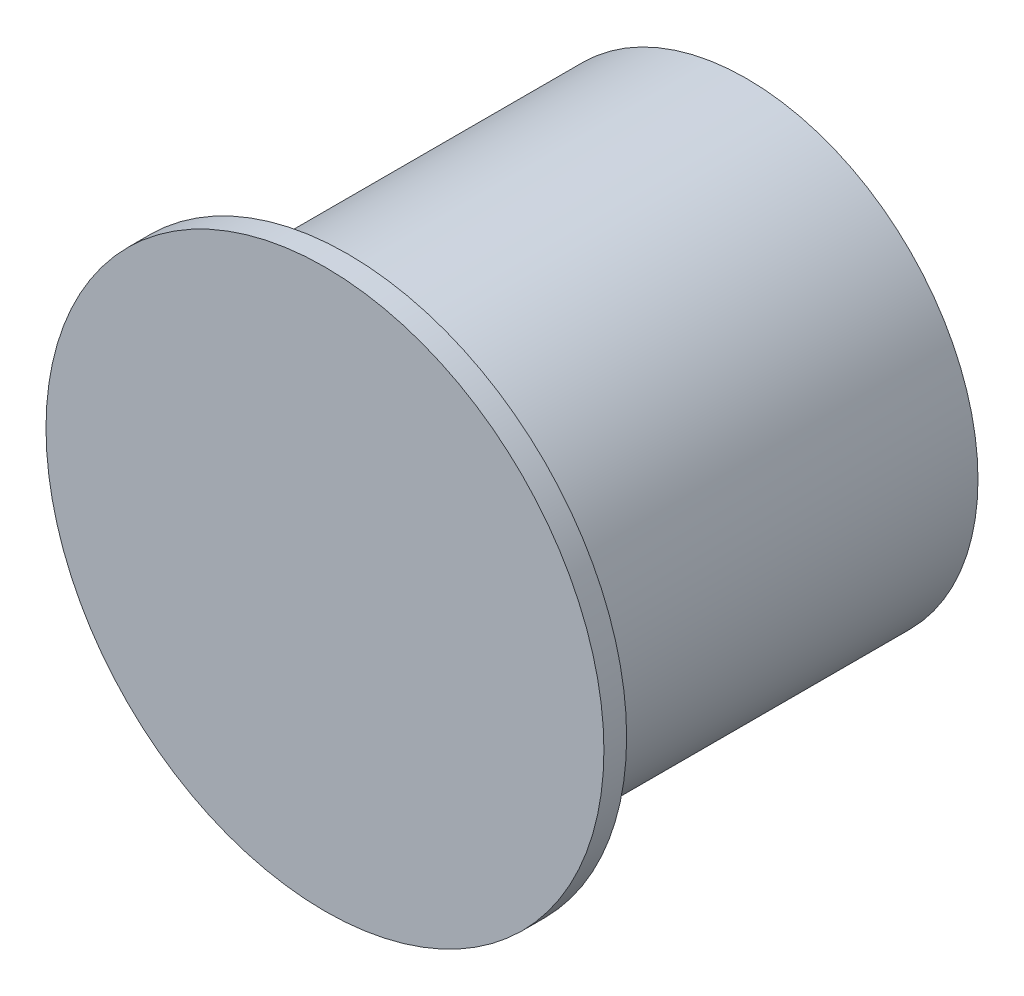
from build123d import *

# Parameters (mm, degrees)
SKETCH_1_R        = 196.5
EXTRUDE_329_DEPTH = 16
SKETCH_3_R        = 163
SKETCH_3_R_2      = 161
EXTRUDE_435_DEPTH = 272
SKETCH_5_R        = 125
SKETCH_5_R_2      = 119
EXTRUDE_523_DEPTH = 208
SKETCH_6_R        = 125
EXTRUDE_605_DEPTH = 2
SKETCH_7_R        = 163
EXTRUDE_691_DEPTH = 9
SKETCH_8_R        = 125
EXTRUDE_738_DEPTH = 16


with BuildPart() as part:
    # Эскиз1 → Extrude 329 (new body)
    with BuildSketch(Plane.XY):
        Circle(SKETCH_1_R)
    extrude(amount=-EXTRUDE_329_DEPTH)

    # Эскиз3 → Extrude 435 (add)
    with BuildSketch(Plane(origin=(0, 0, -16), x_dir=(-1, 0, 0), z_dir=(0, 0, -1))):
        Circle(SKETCH_3_R)
        Circle(SKETCH_3_R_2, mode=Mode.SUBTRACT)
    extrude(amount=EXTRUDE_435_DEPTH)

    # Эскиз7 → Extrude 691 (add)
    with BuildSketch(Plane(origin=(0, 0, -288), x_dir=(-1, 0, 0), z_dir=(0, 0, -1))):
        Circle(SKETCH_7_R)
    extrude(amount=EXTRUDE_691_DEPTH)


with BuildPart() as body_2:
    # Эскиз5 → Extrude 523 (new body)
    with BuildSketch(Plane(origin=(0, 0, -70), x_dir=(-1, 0, 0), z_dir=(0, 0, -1))):
        Circle(SKETCH_5_R)
        Circle(SKETCH_5_R_2, mode=Mode.SUBTRACT)
    extrude(amount=EXTRUDE_523_DEPTH)

    # Эскиз6 → Extrude 605 (add)
    with BuildSketch(Plane(origin=(0, 0, -278), x_dir=(-1, 0, 0), z_dir=(0, 0, -1))):
        Circle(SKETCH_6_R)
    extrude(amount=EXTRUDE_605_DEPTH)


with BuildPart() as body_3:
    # Эскиз8 → Extrude 738 (new body)
    with BuildSketch(Plane(origin=(0, 0, -70), x_dir=(-1, 0, 0), z_dir=(0, 0, -1))):
        Circle(SKETCH_8_R)
    extrude(amount=-EXTRUDE_738_DEPTH)


solid = Compound([part.part, body_2.part, body_3.part])
